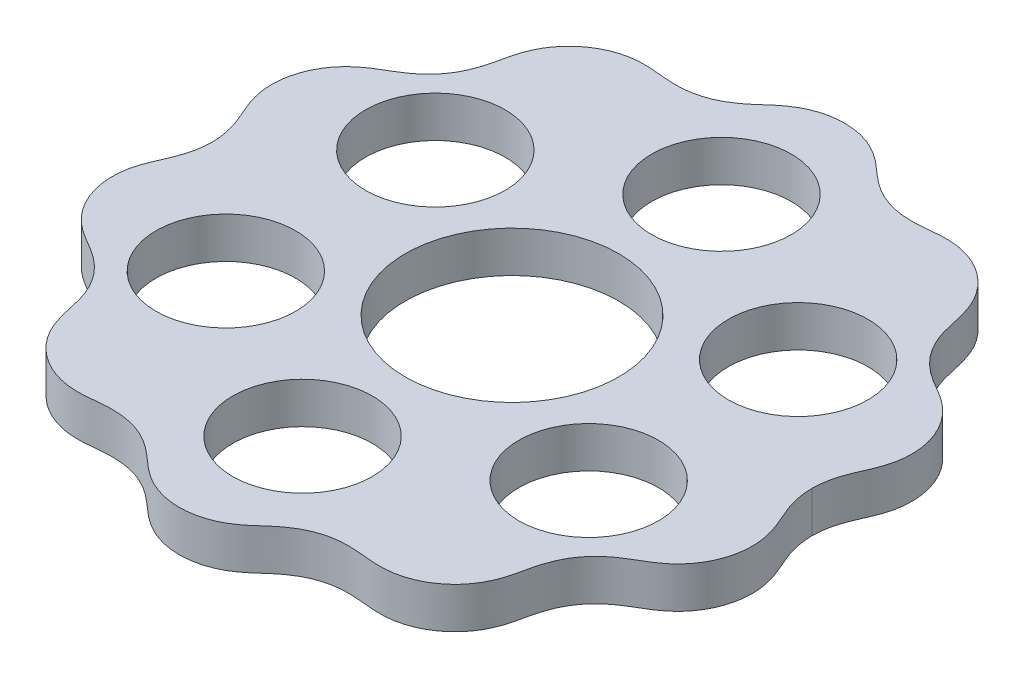
from build123d import *

# Parameters (mm, degrees)
SKETCH1_R           = 13
SKETCH1_R_2         = 8.5
BOSS_EXTRUDE1_DEPTH = 5


with BuildPart() as part:
    # Sketch1 → Boss-Extrude1 (new body)
    with BuildSketch(Plane(origin=(0, 0, 0), x_dir=(1, 0, 0), z_dir=(0, 1, 0))):
        with BuildLine():
            add(Edge.make_bspline(
                [(36.5, 0), (36.5, -0.048499305), (36.500946474, -0.144120136), (36.505205639, -0.349195993), (36.516548144, -0.571582738), (36.53776893, -0.854430115), (36.574407998, -1.196752002), (36.62809738, -1.556988295), (36.70127876, -1.938208043), (36.78047365, -2.281954505), (36.861329003, -2.590026625), (36.973593296, -2.971756615), (37.124850001, -3.424875263), (37.335057521, -3.978884819), (37.610804689, -4.630454515), (37.912979272, -5.308786827), (38.217993537, -6.024773331), (38.579337976, -7.000673113), (38.903566381, -8.266221267), (39.040360932, -9.835827251), (38.833195825, -11.619336074), (38.300146641, -13.287501244), (37.486961222, -14.788321278), (36.519443961, -15.985374971), (35.463247749, -16.921686084), (34.480633006, -17.584395869), (33.651986164, -18.070393448), (32.741397785, -18.599880286), (31.745814237, -19.23037768), (30.644081106, -20.103969946), (29.551914438, -21.316953148), (28.709876259, -22.688378726), (28.129188952, -24.127329092), (27.764036764, -25.53676255), (27.498568237, -26.872010136), (27.14459296, -28.24566423), (26.585858616, -29.613191611), (25.753833767, -30.946724523), (24.630275661, -32.173887031), (23.304067671, -33.178476098), (21.818707229, -33.928039056), (20.354428633, -34.356223626), (18.980021188, -34.522492919), (17.810145148, -34.508679014), (16.856619883, -34.426627197), (15.978233577, -34.333926373), (15.170927755, -34.265741371), (14.149802015, -34.229580128), (12.916311546, -34.297819177), (11.49268827, -34.581382628), (10.018707632, -35.167894044), (8.730716825, -35.94686999), (7.616704888, -36.833430943), (6.627661642, -37.741061624), (5.549118095, -38.667467053), (4.288853719, -39.488783224), (2.83273482, -40.115486753), (1.209906645, -40.482844808), (-0.452411505, -40.551448925), (-2.099959875, -40.319988007), (-3.516029788, -39.847376882), (-4.684831629, -39.236604984), (-5.595122009, -38.603332332), (-6.291293195, -38.03136891), (-6.935196982, -37.455611034), (-7.552937159, -36.905280935), (-8.3720822, -36.227490452), (-9.417339699, -35.501645102), (-10.744745036, -34.835364198), (-12.274940897, -34.396213159), (-13.568324156, -34.246071291), (-14.609253635, -34.240736665), (-15.418369646, -34.285553755), (-16.096609715, -34.346726816), (-16.983957337, -34.439047454), (-18.129700574, -34.534198807), (-19.514247662, -34.499663354), (-21.100124923, -34.177722278), (-22.642688121, -33.554292595), (-24.047237509, -32.662289917), (-25.268485598, -31.532537595), (-26.154336533, -30.347709032), (-26.756076077, -29.20476342), (-27.137211283, -28.192212286), (-27.376331213, -27.351346043), (-27.564158904, -26.521994318), (-27.736255611, -25.71290243), (-27.9936462, -24.634267957), (-28.399117079, -23.379440462), (-29.076792687, -22.004837755), (-30.054056647, -20.718767709), (-31.078771932, -19.746027017), (-32.039482, -19.04146275), (-32.864050638, -18.52796692), (-33.790814113, -17.989908183), (-34.820371489, -17.38242567), (-35.961313043, -16.537601472), (-37.086556652, -15.342606474), (-37.986548491, -13.943319085), (-38.618524242, -12.404128407), (-38.963667013, -10.776717844), (-39.002753109, -9.320975979), (-38.844934454, -8.085734909), (-38.592561063, -7.081267912), (-38.326228914, -6.29696863), (-38.011335485, -5.531557624), (-37.674927383, -4.77594876), (-37.378377228, -4.087797522), (-37.136778411, -3.461265107), (-36.948914251, -2.898248212), (-36.825242681, -2.464456921), (-36.734418474, -2.088562142), (-36.661575892, -1.734972023), (-36.604229284, -1.403741901), (-36.561095025, -1.084527578), (-36.530996656, -0.773408388), (-36.51357757, -0.520248866), (-36.504270411, -0.30979969), (-36.50077644, -0.13220069), (-36.5, -0.043927313), (-36.5, 0)],
                knots=[0.075291946, 0.075291946, 0.075291946, 0.075291946, 0.075291946, 0.076789614, 0.078287282, 0.07978495, 0.081282618, 0.084277954, 0.08727329, 0.089360772, 0.091448255, 0.093535738, 0.09562322, 0.099798186, 0.103973151, 0.109075131, 0.11417711, 0.11927909, 0.12438107, 0.136358468, 0.148336576, 0.160314307, 0.171165011, 0.182015901, 0.19286658, 0.200455433, 0.208044287, 0.213054353, 0.21806442, 0.228084552, 0.238937008, 0.249793369, 0.260645765, 0.270063658, 0.279481551, 0.287924265, 0.29636698, 0.307216588, 0.31806735, 0.328918293, 0.339769011, 0.350619262, 0.361470141, 0.368707076, 0.375944011, 0.381255238, 0.386566466, 0.391877694, 0.397188922, 0.408043704, 0.418896938, 0.42975045, 0.43856656, 0.447382671, 0.456176825, 0.464970979, 0.475821103, 0.486671615, 0.497522231, 0.508373237, 0.519223851, 0.530073652, 0.536457884, 0.542842116, 0.54826674, 0.553691365, 0.55911599, 0.564540614, 0.576145954, 0.586999876, 0.597853142, 0.606065959, 0.610172367, 0.614278775, 0.619102733, 0.62392669, 0.633574604, 0.644425041, 0.655275871, 0.666126278, 0.676977072, 0.687828191, 0.698678662, 0.70471008, 0.710741499, 0.716165428, 0.721589356, 0.727013285, 0.732437214, 0.745249936, 0.756104619, 0.766960924, 0.774569677, 0.78217843, 0.787303815, 0.7924292, 0.802679969, 0.813530568, 0.824380707, 0.835231117, 0.846082101, 0.856932921, 0.867783145, 0.873212041, 0.878640937, 0.884065114, 0.889489291, 0.894913468, 0.900337645, 0.90371728, 0.907096914, 0.910476548, 0.912166365, 0.913856182, 0.91656915, 0.919282118, 0.920638602, 0.921995086, 0.92335157, 0.924708054, 0.924708054, 0.924708054, 0.924708054, 0.924708054], degree=4))
            add(Edge.make_bspline(
                [(-36.5, 0), (-36.5, 0.048499305), (-36.500709854, 0.120347377), (-36.503076032, 0.248821581), (-36.509459135, 0.430805007), (-36.518670462, 0.600909868), (-36.537767816, 0.853780444), (-36.574410609, 1.197161726), (-36.628092737, 1.556776711), (-36.70128534, 1.938275134), (-36.798317842, 2.359473017), (-36.924362877, 2.820443145), (-37.096624147, 3.350360221), (-37.335050856, 3.978935622), (-37.610808448, 4.630425207), (-37.912977339, 5.30880264), (-38.217994227, 6.024766679), (-38.579337761, 7.000676775), (-38.903566296, 8.266218611), (-39.040361318, 9.835829449), (-38.83319516, 11.619334121), (-38.300147751, 13.287503552), (-37.486959297, 14.788317854), (-36.51944727, 15.985380477), (-35.463241983, 16.921676737), (-34.480643682, 17.584412987), (-33.651966589, 18.070362205), (-32.906545987, 18.503912569), (-32.256987734, 18.906587709), (-31.445352143, 19.468675663), (-30.515561037, 20.246660688), (-29.551926436, 21.316972253), (-28.709868851, 22.688366931), (-28.129194123, 24.127337321), (-27.764033611, 25.53675754), (-27.498569959, 26.872012871), (-27.144592106, 28.24566287), (-26.585859124, 29.613192421), (-25.753833457, 30.946724029), (-24.630275847, 32.173887326), (-23.304067555, 33.178475912), (-21.818707307, 33.928039181), (-20.354428582, 34.356223545), (-18.980021222, 34.522492971), (-17.810145124, 34.508678977), (-16.856619896, 34.426627224), (-15.978233572, 34.333926353), (-15.170927757, 34.265741379), (-14.149802015, 34.229580123), (-12.916311545, 34.29781918), (-11.492688271, 34.581382626), (-10.018707631, 35.167894044), (-8.730716827, 35.94686999), (-7.616704884, 36.833430941), (-6.627661644, 37.741061623), (-5.549118097, 38.667467054), (-4.288853718, 39.488783222), (-2.832734821, 40.115486753), (-1.209906645, 40.482844807), (0.452411504, 40.551448925), (2.099959876, 40.319988007), (3.516029787, 39.847376881), (4.68483163, 39.236604984), (5.595122006, 38.60333233), (6.291293204, 38.031368915), (6.935196973, 37.455611027), (7.552937162, 36.905280937), (8.372082197, 36.227490449), (9.417339701, 35.501645103), (10.744745035, 34.835364195), (12.274940897, 34.396213161), (13.568324156, 34.246071287), (14.609253634, 34.240736671), (15.418369647, 34.285553746), (16.096609716, 34.346726821), (16.983957335, 34.439047449), (18.129700573, 34.534198813), (19.514247663, 34.499663349), (21.100124923, 34.17772228), (22.642688121, 33.554292593), (24.047237508, 32.662289917), (25.268485599, 31.532537594), (26.154336531, 30.347709032), (26.756076079, 29.204763419), (27.137211278, 28.192212287), (27.376331225, 27.351346041), (27.564158894, 26.521994319), (27.736255613, 25.712902429), (27.993646196, 24.634267958), (28.399117082, 23.37944046), (29.076792686, 22.004837756), (30.054056648, 20.718767707), (31.078771932, 19.74602702), (32.039481999, 19.041462745), (32.864050639, 18.527966924), (33.790814111, 17.98990817), (34.82037149, 17.382425694), (35.961313043, 16.537601441), (37.086556651, 15.342606512), (37.986548494, 13.94331903), (38.618524236, 12.404128495), (38.963667022, 10.77671769), (39.002753094, 9.320976227), (38.844934477, 8.085734521), (38.592561023, 7.081268579), (38.32622901, 6.296967044), (38.011335306, 5.531560737), (37.674927708, 4.775943023), (37.37837668, 4.087807125), (37.136779297, 3.461249479), (36.969310994, 2.959402658), (36.860578901, 2.58836954), (36.779829118, 2.276540793), (36.721424729, 2.02544297), (36.661575157, 1.735036695), (36.604229765, 1.403615039), (36.561094779, 1.084737296), (36.530996745, 0.773135873), (36.515319468, 0.545818588), (36.507760589, 0.388500267), (36.502523425, 0.222042212), (36.500582329, 0.109223844), (36.5, 0.043927313), (36.5, 0)],
                knots=[0.075291946, 0.075291946, 0.075291946, 0.075291946, 0.075291946, 0.076789614, 0.077538448, 0.078287282, 0.07978495, 0.081282618, 0.084277954, 0.08727329, 0.089360772, 0.091448255, 0.09562322, 0.099798186, 0.103973151, 0.109075131, 0.11417711, 0.11927909, 0.12438107, 0.136358468, 0.148336576, 0.160314307, 0.171165011, 0.182015901, 0.19286658, 0.200455433, 0.208044287, 0.213054353, 0.21806442, 0.223074486, 0.228084552, 0.238937008, 0.249793369, 0.260645765, 0.270063658, 0.279481551, 0.287924265, 0.29636698, 0.307216588, 0.31806735, 0.328918293, 0.339769011, 0.350619262, 0.361470141, 0.368707076, 0.375944011, 0.381255238, 0.386566466, 0.391877694, 0.397188922, 0.408043704, 0.418896938, 0.42975045, 0.43856656, 0.447382671, 0.456176825, 0.464970979, 0.475821103, 0.486671615, 0.497522231, 0.508373237, 0.519223851, 0.530073652, 0.536457884, 0.542842116, 0.54826674, 0.553691365, 0.55911599, 0.564540614, 0.576145954, 0.586999876, 0.597853142, 0.606065959, 0.610172367, 0.614278775, 0.619102733, 0.62392669, 0.633574604, 0.644425041, 0.655275871, 0.666126278, 0.676977072, 0.687828191, 0.698678662, 0.70471008, 0.710741499, 0.716165428, 0.721589356, 0.727013285, 0.732437214, 0.745249936, 0.756104619, 0.766960924, 0.774569677, 0.78217843, 0.787303815, 0.7924292, 0.802679969, 0.813530568, 0.824380707, 0.835231117, 0.846082101, 0.856932921, 0.867783145, 0.873212041, 0.878640937, 0.884065114, 0.889489291, 0.894913468, 0.900337645, 0.90371728, 0.907096914, 0.908786731, 0.910476548, 0.912166365, 0.913856182, 0.91656915, 0.919282118, 0.920638602, 0.921995086, 0.922673328, 0.92335157, 0.924708054, 0.924708054, 0.924708054, 0.924708054, 0.924708054], degree=4))
        make_face()
        Circle(SKETCH1_R, mode=Mode.SUBTRACT)
        with Locations((0, 25.5)):
            Circle(SKETCH1_R_2, mode=Mode.SUBTRACT)
        with Locations((22.083647797, 12.75)):
            Circle(SKETCH1_R_2, mode=Mode.SUBTRACT)
        with Locations((22.083647797, -12.75)):
            Circle(SKETCH1_R_2, mode=Mode.SUBTRACT)
        with Locations((0, -25.5)):
            Circle(SKETCH1_R_2, mode=Mode.SUBTRACT)
        with Locations((-22.083647797, -12.75)):
            Circle(SKETCH1_R_2, mode=Mode.SUBTRACT)
        with Locations((-22.083647797, 12.75)):
            Circle(SKETCH1_R_2, mode=Mode.SUBTRACT)
    extrude(amount=BOSS_EXTRUDE1_DEPTH)


solid = part.part
